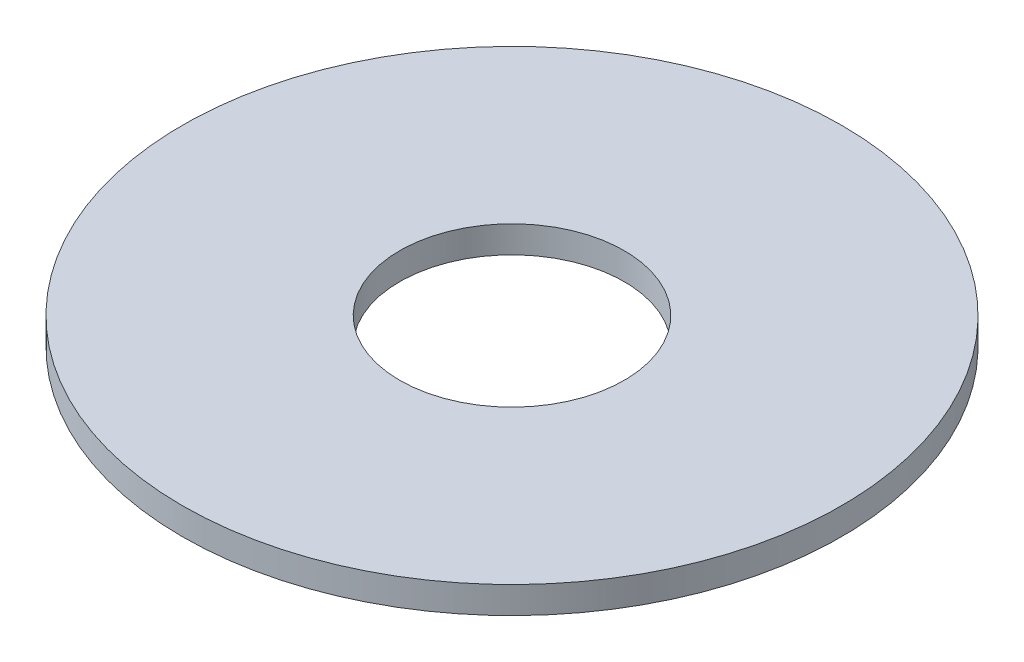
from build123d import *

# Parameters (mm, degrees)
SKETCH_1_R      = 49
SKETCH_1_R_2    = 16.7
EXTRUDE_1_DEPTH = 4


with BuildPart() as part:
    # Эскиз1 → Бобышка-Вытянуть1 (new body)
    with BuildSketch(Plane(origin=(0, 0, 0), x_dir=(1, 0, 0), z_dir=(0, 1, 0))):
        Circle(SKETCH_1_R)
        Circle(SKETCH_1_R_2, mode=Mode.SUBTRACT)
    extrude(amount=EXTRUDE_1_DEPTH)


solid = part.part
